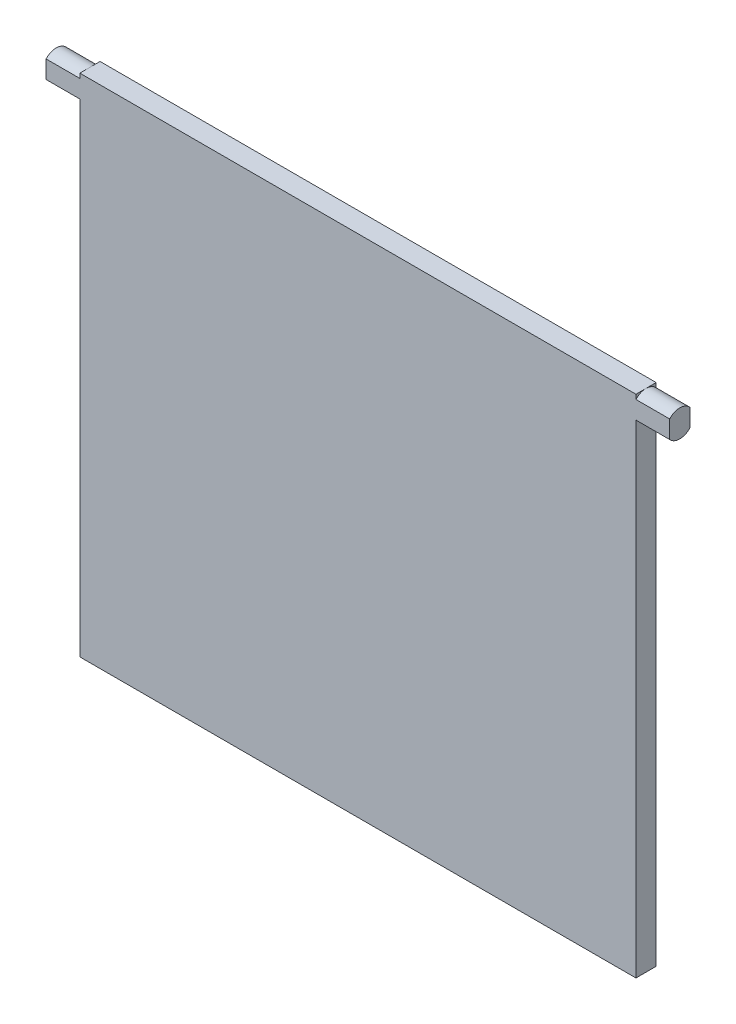
from build123d import *

# Parameters (mm, degrees)
BOSS_EXTRUDE1_DEPTH = 1.2
BOSS_EXTRUDE3_DEPTH = 2


# Read off the part's stored shape, not the designer's step: Boss-Extrude3
with BuildPart() as part:
    # Sketch1 → Boss-Extrude1 (new body)
    with BuildSketch(Plane.XY):
        Polygon((0, 0), (33, 0), (33, -1.2), (33, -30), (0, -30), (0, -1.2), align=None)
    extrude(amount=BOSS_EXTRUDE1_DEPTH)

    # Boss-Extrude3 outline → Boss-Extrude3 (add)
    with BuildSketch(Plane(origin=(33, 0, 0), x_dir=(0, 0, -1), z_dir=(1, 0, 0))):
        with BuildLine():
            ThreePointArc((0, -0.270849738), (-0.6, 0), (-1.2, -0.270849738))
            Line((-1.2, -0.270849738), (-1.2, -1.329150262))
            ThreePointArc((-1.2, -1.329150262), (-0.6, -1.6), (0, -1.329150262))
            Line((0, -1.329150262), (0, -0.270849738))
        make_face()
    boss_extrude3 = extrude(amount=BOSS_EXTRUDE3_DEPTH)

    # Mirror1: Boss-Extrude3 across plane
    add(boss_extrude3.mirror(Plane.ZY.offset(-16.5)))


solid = part.part
